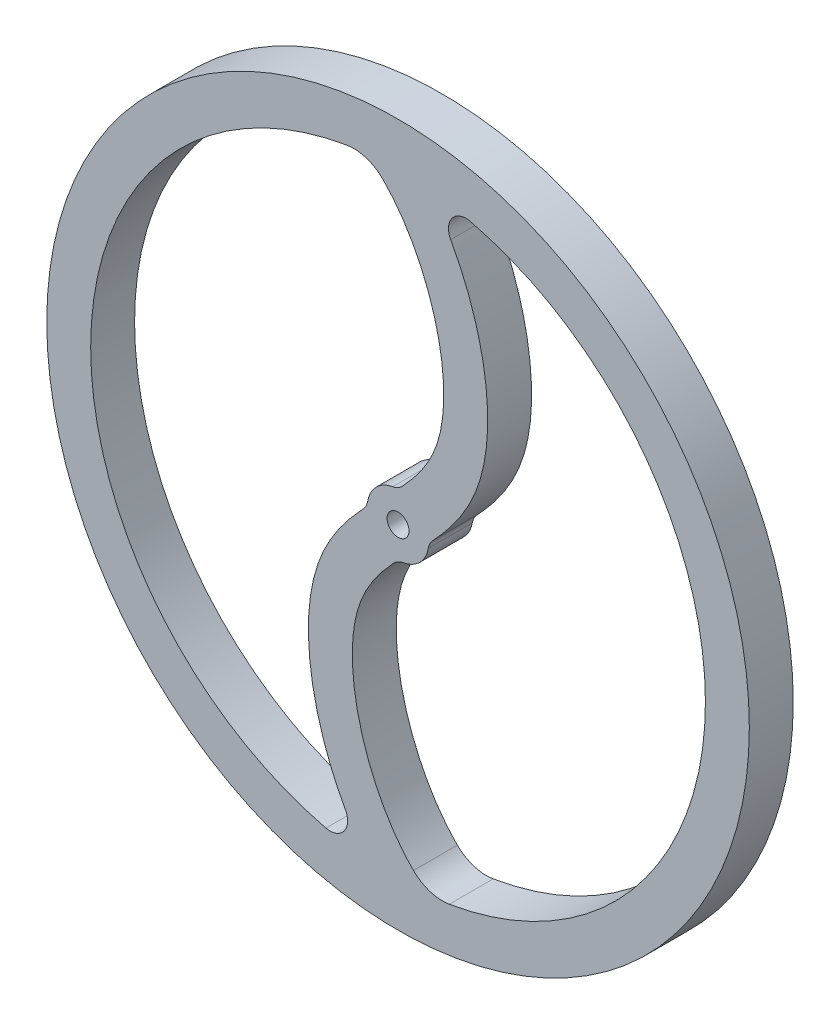
from build123d import *

# Parameters (mm, degrees)
ESQUISSE1_R                  = 400
ESQUISSE1_R_2                = 350
BOSS_EXTRU_1_DEPTH           = 50
EXTRU_MINCE1_START           = -50
EXTRU_MINCE1_DEPTH           = 50
BOSS_EXTRU_2_START           = -50
BOSS_EXTRU_2_DEPTH           = 50
ENL_V_MAT_EXTRU_1_DEPTH      = 568.89083473
ENL_V_MAT_EXTRU_1_DEPTH_BACK = 568.89083473
ESQUISSE4_R                  = 12.5
ESQUISSE5_R                  = 35
ESQUISSE5_R_2                = 12.5
BOSS_EXTRU_3_DEPTH           = 50
CONG_2_R                     = 20


# Read off the part's stored shape, not the designer's step: Extru.-Mince1
with BuildPart() as part:
    # Esquisse1 → Boss.-Extru.1 (new body)
    with BuildSketch(Plane.XY):
        Circle(ESQUISSE1_R)
        Circle(ESQUISSE1_R_2, mode=Mode.SUBTRACT)
    extrude(amount=BOSS_EXTRU_1_DEPTH)

    # Extru.-Mince1 outline → Extru.-Mince1 (add)
    with BuildSketch(Plane.XY.offset(50).offset(EXTRU_MINCE1_START)):
        with BuildLine():
            add(Edge.make_bspline(
                [(-17.578582702, 332.223795956), (-13.006029397, 327.702076571), (-8.525799104, 322.703406145), (0.139661855, 311.878345733), (4.324902329, 306.052383763), (12.306325082, 293.716264205), (16.102617705, 287.206307092), (23.226392886, 273.652542218), (26.553972592, 266.608809401), (35.730163441, 244.906938456), (40.768636512, 229.677168598), (46.367738516, 206.627670241), (47.908578076, 198.910612565), (50.294392784, 183.568496034), (51.139268661, 175.94345939), (52.098340216, 160.947531132), (52.21238025, 153.576755976), (51.68889352, 139.252087771), (51.051205988, 132.298518999), (49.529565248, 122.298741474), (48.928334221, 119.037172715), (47.539683848, 112.675350651), (46.752582578, 109.576215008), (44.114742474, 100.538037841), (41.977452484, 94.806766085), (36.834878855, 83.551557811), (33.826996348, 78.025173728), (26.773354915, 66.867395642), (22.725430524, 61.236927426), (13.447578047, 49.660158587), (8.217643624, 43.715682454), (-3.507548172, 31.349570896), (-10.001973073, 24.928879975), (-24.829724062, 10.949936653), (-31.984427814, 3.887364914), (-45.291841947, -10.147456059), (-51.445384798, -17.120649798), (-62.760428782, -31.239396452), (-67.921923577, -38.386773856), (-77.204655719, -53.070631299), (-81.323727601, -60.608037124), (-88.444191242, -76.192121488), (-91.442984134, -84.236352462), (-95.084809692, -96.714540413), (-96.153499672, -100.931355257), (-98.014122409, -109.455423671), (-98.80637413, -113.763724761), (-100.790556161, -126.803188246), (-101.590583179, -135.648622106), (-102.243982659, -153.528217171), (-102.097194354, -162.562702654), (-100.936524717, -180.710794438), (-99.922487739, -189.824517197), (-97.092850599, -208.020658997), (-95.277151165, -217.103100248), (-88.710884536, -244.134069098), (-82.844776318, -261.867237944), (-72.075342178, -287.337160454), (-68.156254712, -295.638589688), (-59.690902904, -311.744851476), (-55.14473571, -319.549758973), (-45.517052393, -334.430345572), (-40.444476295, -341.515238116), (-35.080643578, -348.237488571)],
                knots=[0, 0, 0, 0, 0.0625, 0.0625, 0.125, 0.125, 0.1875, 0.1875, 0.25, 0.25, 0.375, 0.375, 0.4375, 0.4375, 0.5, 0.5, 0.5625, 0.5625, 0.625, 0.625, 0.65625, 0.65625, 0.6875, 0.6875, 0.75, 0.75, 0.8125, 0.8125, 0.875, 0.875, 0.9375, 0.9375, 1, 1, 1.06716091, 1.06716091, 1.134321821, 1.134321821, 1.201482731, 1.201482731, 1.268643642, 1.268643642, 1.335804552, 1.335804552, 1.369385007, 1.369385007, 1.402965463, 1.402965463, 1.470126373, 1.470126373, 1.537287283, 1.537287283, 1.604448194, 1.604448194, 1.671609104, 1.671609104, 1.805930925, 1.805930925, 1.873091836, 1.873091836, 1.940252746, 1.940252746, 2.00642831, 2.00642831, 2.00642831, 2.00642831], degree=3))
            ThreePointArc((-35.080643578, -348.237488571), (-17.562445732, -349.559094432), (0, -350))
            Line((0, -350), (17.578582702, -332.223795956))
            add(Edge.make_bspline(
                [(17.578582702, -332.223795956), (13.006029397, -327.702076571), (8.525799104, -322.703406145), (-0.139661855, -311.878345733), (-4.324902329, -306.052383763), (-12.306325082, -293.716264205), (-16.102617705, -287.206307092), (-23.226392886, -273.652542218), (-26.553972592, -266.608809401), (-35.730163441, -244.906938456), (-40.768636512, -229.677168598), (-46.367738516, -206.627670241), (-47.908578076, -198.910612565), (-50.294392784, -183.568496034), (-51.139268661, -175.94345939), (-52.098340216, -160.947531132), (-52.21238025, -153.576755976), (-51.68889352, -139.252087771), (-51.051205988, -132.298518999), (-49.529565248, -122.298741474), (-48.928334221, -119.037172715), (-47.539683848, -112.675350651), (-46.752582578, -109.576215008), (-44.114742474, -100.538037841), (-41.977452484, -94.806766085), (-36.834878855, -83.551557811), (-33.826996348, -78.025173728), (-26.773354915, -66.867395642), (-22.725430524, -61.236927426), (-13.447578047, -49.660158587), (-8.217643624, -43.715682454), (3.507548172, -31.349570896), (10.001973073, -24.928879975), (24.829724062, -10.949936653), (31.984427814, -3.887364914), (45.291841947, 10.147456059), (51.445384798, 17.120649798), (62.760428782, 31.239396452), (67.921923577, 38.386773856), (77.204655719, 53.070631299), (81.323727601, 60.608037124), (88.444191242, 76.192121488), (91.442984134, 84.236352462), (95.084809692, 96.714540413), (96.153499672, 100.931355257), (98.014122409, 109.455423671), (98.80637413, 113.763724761), (100.790556161, 126.803188246), (101.590583179, 135.648622106), (102.243982659, 153.528217171), (102.097194354, 162.562702654), (100.936524717, 180.710794438), (99.922487739, 189.824517197), (97.092850599, 208.020658997), (95.277151165, 217.103100248), (88.710884536, 244.134069098), (82.844776318, 261.867237944), (72.075342178, 287.337160454), (68.156254712, 295.638589688), (59.690902904, 311.744851476), (55.14473571, 319.549758973), (45.517052393, 334.430345572), (40.444476295, 341.515238116), (35.080643578, 348.237488571)],
                knots=[0, 0, 0, 0, 0.0625, 0.0625, 0.125, 0.125, 0.1875, 0.1875, 0.25, 0.25, 0.375, 0.375, 0.4375, 0.4375, 0.5, 0.5, 0.5625, 0.5625, 0.625, 0.625, 0.65625, 0.65625, 0.6875, 0.6875, 0.75, 0.75, 0.8125, 0.8125, 0.875, 0.875, 0.9375, 0.9375, 1, 1, 1.06716091, 1.06716091, 1.134321821, 1.134321821, 1.201482731, 1.201482731, 1.268643642, 1.268643642, 1.335804552, 1.335804552, 1.369385007, 1.369385007, 1.402965463, 1.402965463, 1.470126373, 1.470126373, 1.537287283, 1.537287283, 1.604448194, 1.604448194, 1.671609104, 1.671609104, 1.805930925, 1.805930925, 1.873091836, 1.873091836, 1.940252746, 1.940252746, 2.00642831, 2.00642831, 2.00642831, 2.00642831], degree=3))
            ThreePointArc((35.080643578, 348.237488571), (17.562445732, 349.559094432), (0, 350))
            Line((0, 350), (-17.578582702, 332.223795956))
        make_face()
    extrude(amount=EXTRU_MINCE1_DEPTH)

    # Esquisse3 → Boss.-Extru.2 (add)
    with BuildSketch(Plane.XY.offset(50).offset(BOSS_EXTRU_2_START)):
        with BuildLine():
            Line((-17.578582702, 332.223795956), (0, 350))
            ThreePointArc((0, 350), (-29.266098764, 348.774275805), (-58.327213726, 345.105688361))
            ThreePointArc((-58.327213726, 345.105688361), (-36.398453128, 343.581838752), (-17.578582702, 332.223795956))
        make_face()
        with BuildLine():
            Line((17.578582702, -332.223795956), (0, -350))
            ThreePointArc((0, -350), (29.266098764, -348.774275805), (58.327213726, -345.105688361))
            ThreePointArc((58.327213726, -345.105688361), (36.398453128, -343.581838752), (17.578582702, -332.223795956))
        make_face()
    extrude(amount=BOSS_EXTRU_2_DEPTH)

    # Esquisse4 → Enlèv. mat.-Extru.1 (cut, two sides: drawn at the far end of the back side and taken through both)
    with BuildSketch(Plane.XY.offset(50).offset(-ENL_V_MAT_EXTRU_1_DEPTH_BACK)):
        Circle(ESQUISSE4_R)
    extrude(amount=ENL_V_MAT_EXTRU_1_DEPTH + ENL_V_MAT_EXTRU_1_DEPTH_BACK, mode=Mode.SUBTRACT)

    # Esquisse5 → Boss.-Extru.3 (add)
    with BuildSketch(Plane.XY.offset(50)):
        Circle(ESQUISSE5_R)
        Circle(ESQUISSE5_R_2, mode=Mode.SUBTRACT)
    extrude(amount=-BOSS_EXTRU_3_DEPTH)

    # Congé2
    cong_2_edges = [part.edges().sort_by_distance(p)[0] for p in [
        (35.080643578, 348.237488571, 25),
        (-35.080643578, -348.237488571, 25),
        (34.993639035, -0.667253389, 25),
        (0.068739934, -34.999932497, 25),
        (-0.068739934, 34.999932497, 25),
        (-34.993639035, 0.667253389, 25),
    ]]
    fillet(cong_2_edges, radius=CONG_2_R)


solid = part.part
